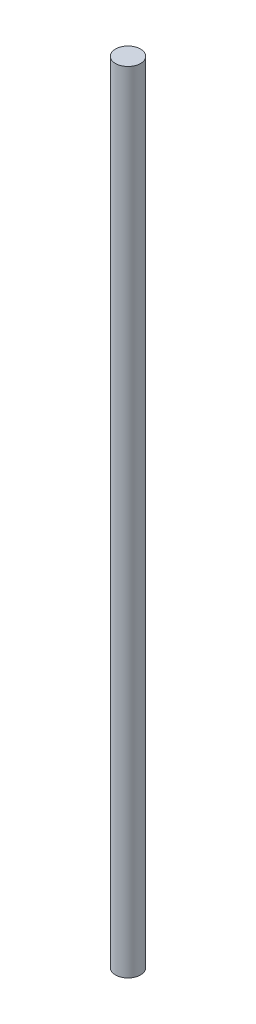
from build123d import *

# Parameters (mm, degrees)
SKETCH1_R           = 0.79375
BOSS_EXTRUDE1_DEPTH = 50


with BuildPart() as part:
    # Sketch1 → Boss-Extrude1 (new body)
    with BuildSketch(Plane(origin=(0, 0, 0), x_dir=(1, 0, 0), z_dir=(0, 1, 0))):
        Circle(SKETCH1_R)
    extrude(amount=BOSS_EXTRUDE1_DEPTH)


solid = part.part
